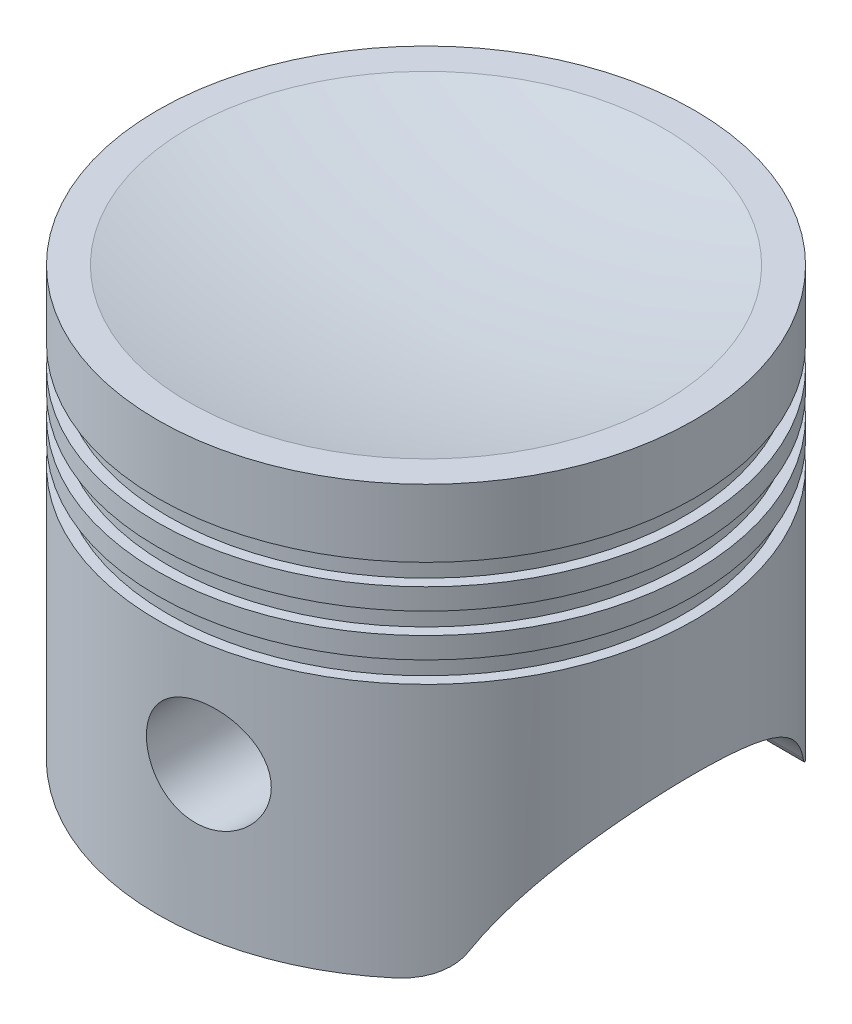
from build123d import *

# Parameters (mm, degrees)
SKETCH2_W                = 2.5
SKETCH2_H                = 5
LPATTERN1_COUNT          = 3
LPATTERN1_PITCH          = 10
CUT_EXTRUDE1_DEPTH       = 118.194667114
CUT_EXTRUDE1_DEPTH_BACK  = 118.194667114
SKETCH3_R                = 12.7
CUT_EXTRUDE3_DEPTH       = 118.194667297
CUT_EXTRUDE3_DEPTH_BACK  = 118.194667297
FILLET1_R                = 10
BOSS_EXTRUDE1_REACH      = 149.195
BOSS_EXTRUDE1_END_RADIUS = 57.15
BOSS_EXTRUDE1_START      = 30
SKETCH5_R                = 15.2
SKETCH5_R_2              = 12.7


with BuildPart() as part:
    # Sketch1 → Revolve1 (revolve)
    with BuildSketch(Plane.XY, mode=Mode.PRIVATE) as revolve1_sk:
        with BuildLine():
            Line((0, 19), (0, 0))
            Line((0, 0), (57.15, 0))
            Line((57.15, 0), (57.15, -75.3))
            Line((57.15, -75.3), (63.5, -75.3))
            Line((63.5, -75.3), (63.5, 26))
            Line((63.5, 26), (56.15, 26))
            ThreePointArc((56.15, 26), (28.278100119, 20.870846903), (0, 19))
        make_face()
    revolve(revolve1_sk.sketch.rotate(Axis((0, 19, 0), (0, -1, 0)), 180), axis=Axis((0, 19, 0), (0, -1, 0)))

    # Sketch2 → Cut-Revolve1 (revolve, cut)
    with BuildSketch(Plane.XY, mode=Mode.PRIVATE) as cut_revolve1_sk:
        with Locations((62.25, 7.5)):
            Rectangle(SKETCH2_W, SKETCH2_H)
    cut_revolve1 = revolve(cut_revolve1_sk.sketch.rotate(Axis((0, 0, 0), (0, 1, 0)), 180), axis=Axis((0, 0, 0), (0, 1, 0)), mode=Mode.SUBTRACT)

    # LPattern1: Cut-Revolve1 ×3
    with Locations(*[(0, -i * LPATTERN1_PITCH, 0) for i in range(1, LPATTERN1_COUNT)]):
        add(cut_revolve1, mode=Mode.SUBTRACT)

    # Sketch3 → Cut-Extrude1 (cut, two sides: drawn at the far end of the back side and taken through both)
    with BuildSketch(Plane.XY.offset(-CUT_EXTRUDE1_DEPTH_BACK)):
        with Locations((10, -40)):
            Circle(SKETCH3_R)
    extrude(amount=CUT_EXTRUDE1_DEPTH + CUT_EXTRUDE1_DEPTH_BACK, mode=Mode.SUBTRACT)

    # Sketch4 → Cut-Extrude3 (cut, two sides: drawn at the far end of the back side and taken through both)
    with BuildSketch(Plane(origin=(0, 0, 0), x_dir=(0, 0, -1), z_dir=(1, 0, 0)).offset(-CUT_EXTRUDE3_DEPTH_BACK)):
        with BuildLine():
            Line((-150.607887102, -357.651696537), (-42, -75.3))
            ThreePointArc((-42, -75.3), (0, -46.455494421), (42, -75.3))
            Line((42, -75.3), (150.607887102, -357.651696537))
            Line((150.607887102, -357.651696537), (150.607887102, -962.691046259))
            Line((150.607887102, -962.691046259), (-150.607887102, -962.691046259))
            Line((-150.607887102, -962.691046259), (-150.607887102, -357.651696537))
        make_face()
    extrude(amount=CUT_EXTRUDE3_DEPTH + CUT_EXTRUDE3_DEPTH_BACK, mode=Mode.SUBTRACT)

    # Fillet1
    # the kernel refuses this fillet: 10 mm, written as the material it takes off along each edge
    with BuildSketch(Plane(origin=(63.583013308, -75.3, 42), x_dir=(0, 0.9083807758809636, -0.41814395369286256), z_dir=(-1, 0, 0)), Plane(origin=(-22.800360105, -75.3, 42), x_dir=(0, 0.9083807758809636, -0.41814395369286256), z_dir=(-1, 0, 0))) as fillet1_piece_1:
        with BuildLine():
            CenterArc((6.414901106, -9.979403311), FILLET1_R, 93.67799309, 61.604544038)
            Line((-2.668906652, -5.797963774), (0, 0))
            ThreePointArc((0, 0), (2.886705498, -0.092685102), (5.773410996, 0))
        make_face()
    extrude(amount=40.782653203, mode=Mode.SUBTRACT)
    with BuildSketch(Plane(origin=(63.583013308, -75.3, -42), x_dir=(0, 0, -1), z_dir=(-1, 0, 0))) as fillet1_piece_2:
        with BuildLine():
            CenterArc((6.382746011, -10), FILLET1_R, 90, 61.604544038)
            ThreePointArc((-2.4141169, -5.24445556), (-1.122865085, -2.660983495), (0, 0))
            Line((0, 0), (6.382746011, 0))
        make_face()
    extrude(amount=40.782653203, mode=Mode.SUBTRACT)
    with BuildSketch(Plane(origin=(-22.800360105, -75.3, -42), x_dir=(0, 0.9083807758809641, 0.4181439536928614), z_dir=(-1, 0, 0))) as fillet1_piece_3:
        with BuildLine():
            CenterArc((6.414901106, 9.979403311), FILLET1_R, 204.717462871, 61.604544038)
            Line((-2.668906652, 5.797963774), (0, 0))
            ThreePointArc((0, 0), (2.886705498, 0.092685102), (5.773410996, 0))
        make_face()
    extrude(amount=40.782653203, mode=Mode.SUBTRACT)

    # Boss-Extrude1: up to this cylinder (the profile starts inside it)
    boss_extrude1_end = Plane(origin=(0, -40, 0), z_dir=(0, 1, 0)) * Cylinder(BOSS_EXTRUDE1_END_RADIUS, 413.69, mode=Mode.PRIVATE)
    # Sketch5 → Boss-Extrude1 (add, up to the surface)
    with BuildSketch(Plane.XY.offset(BOSS_EXTRUDE1_START), mode=Mode.PRIVATE) as boss_extrude1_sk1:
        with Locations(Location((10, -40, 0), (0, 0, 180))):
            Circle(SKETCH5_R)
        with Locations((10, -40)):
            Circle(SKETCH5_R_2, mode=Mode.SUBTRACT)
    boss_extrude1_tool1 = extrude(boss_extrude1_sk1.sketch, amount=BOSS_EXTRUDE1_REACH, mode=Mode.PRIVATE) & boss_extrude1_end
    boss_extrude1 = boss_extrude1_tool1.solids().sort_by_distance((24.770079, -40, 30))[0]
    add(boss_extrude1)

    # Mirror1: Boss-Extrude1 across plane
    add(boss_extrude1.mirror(Plane.XY))


solid = part.part
